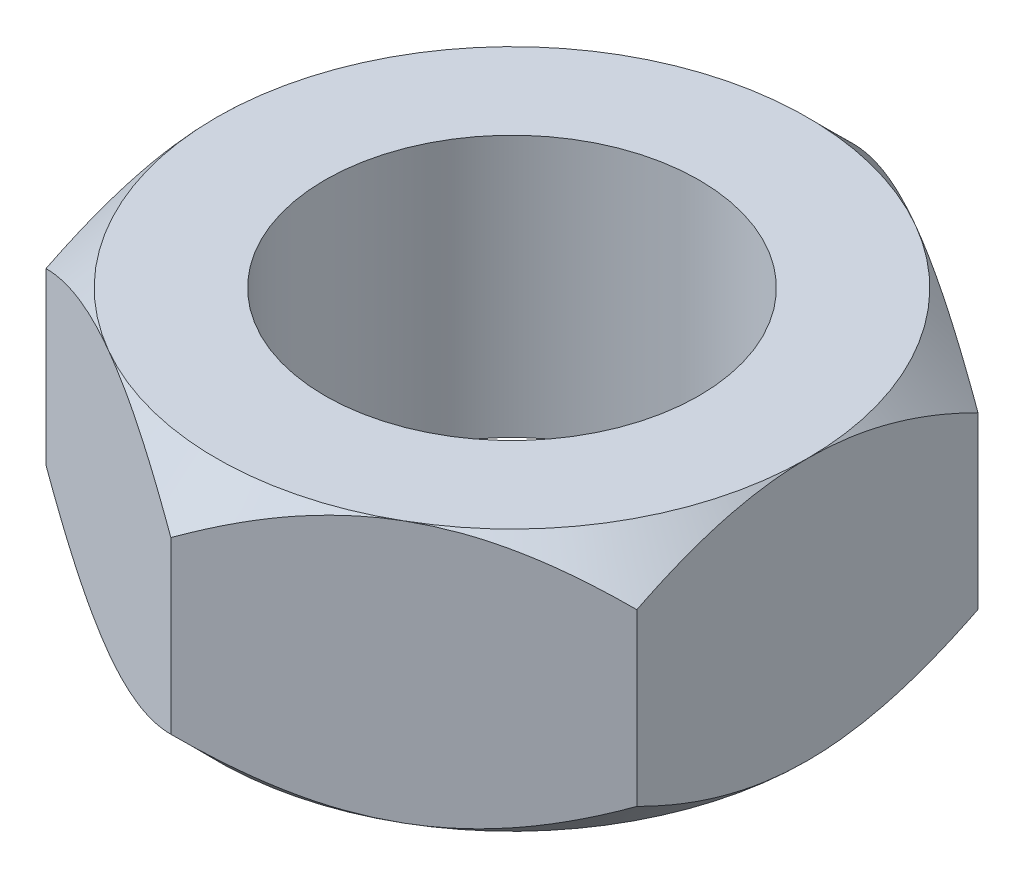
from build123d import *

# Parameters (mm, degrees)
BOSS_EXTRUDE1_DEPTH     = 3.5
CUT_EXTRUDE1_DEPTH      = 7.975373347
CUT_EXTRUDE1_DEPTH_BACK = 7.975373347
SKETCH2_R               = 2.5
SKETCH4_OUTSIDE_W       = 79.412
SKETCH4_OUTSIDE_H       = 80.634
SKETCH4_OUTSIDE_R       = 3.95
CUT_EXTRUDE4_DEPTH      = 33.5
CUT_EXTRUDE4_DRAFT      = -45


# Read off the part's stored shape, not the designer's step: Cut-Extrude2
with BuildPart() as part:
    # Sketch1 → Boss-Extrude1 (new body)
    with BuildSketch(Plane(origin=(0, 0, 0), x_dir=(1, 0, 0), z_dir=(0, 1, 0))):
        Polygon((3.95, -2.280533563), (3.95, 2.280533563), (0, 4.561067127), (-3.95, 2.280533563), (-3.95, -2.280533563), (0, -4.561067127), align=None)
    extrude(amount=BOSS_EXTRUDE1_DEPTH)

    # Sketch2 → Cut-Extrude1 (cut, two sides: drawn at the far end of the back side and taken through both)
    with BuildSketch(Plane(origin=(0, 3.5, 0), x_dir=(1, 0, 0), z_dir=(0, 1, 0)).offset(-CUT_EXTRUDE1_DEPTH_BACK)):
        with Locations(Location((0, 0, 0), (0, 0, 270))):
            Circle(SKETCH2_R)
    extrude(amount=CUT_EXTRUDE1_DEPTH + CUT_EXTRUDE1_DEPTH_BACK, mode=Mode.SUBTRACT)

    # Cut-Extrude2 outline → Cut-Extrude2 (revolve, cut)
    with BuildSketch(Plane.XY):
        Polygon((4.561067183, 3.500000074), (3.949999968, 3.500000074), (4.561067135, 2.888932865), align=None)
    revolve(axis=Axis((0, 0, 0), (0, 1, 0)), mode=Mode.SUBTRACT)


with BuildPart() as cut_extrude4_tool:
    # Sketch4 outside → Cut-Extrude4 (with draft: the straight prism first)
    with BuildSketch(Plane.XZ):
        Rectangle(SKETCH4_OUTSIDE_W, SKETCH4_OUTSIDE_H)
        Circle(SKETCH4_OUTSIDE_R, mode=Mode.SUBTRACT)
    extrude(amount=-CUT_EXTRUDE4_DEPTH)
    # Cut-Extrude4: the draft: its side faces are tilted about the plane it starts from
    cut_extrude4_sides = [cut_extrude4_tool.faces().sort_by_distance(p)[0] for p in [
        (0, 16.75, -40.317),
        (39.706, 16.75, 0),
        (0, 16.75, 40.317),
        (-39.706, 16.75, 0),
        (-3.95, 16.75, 0),
    ]]
    draft(cut_extrude4_sides, Plane.XZ, CUT_EXTRUDE4_DRAFT)


with BuildPart() as part_1:
    add(part.part)

    # Cut-Extrude4: cut by cut_extrude4_tool
    add(cut_extrude4_tool.part, mode=Mode.SUBTRACT)


solid = part_1.part
